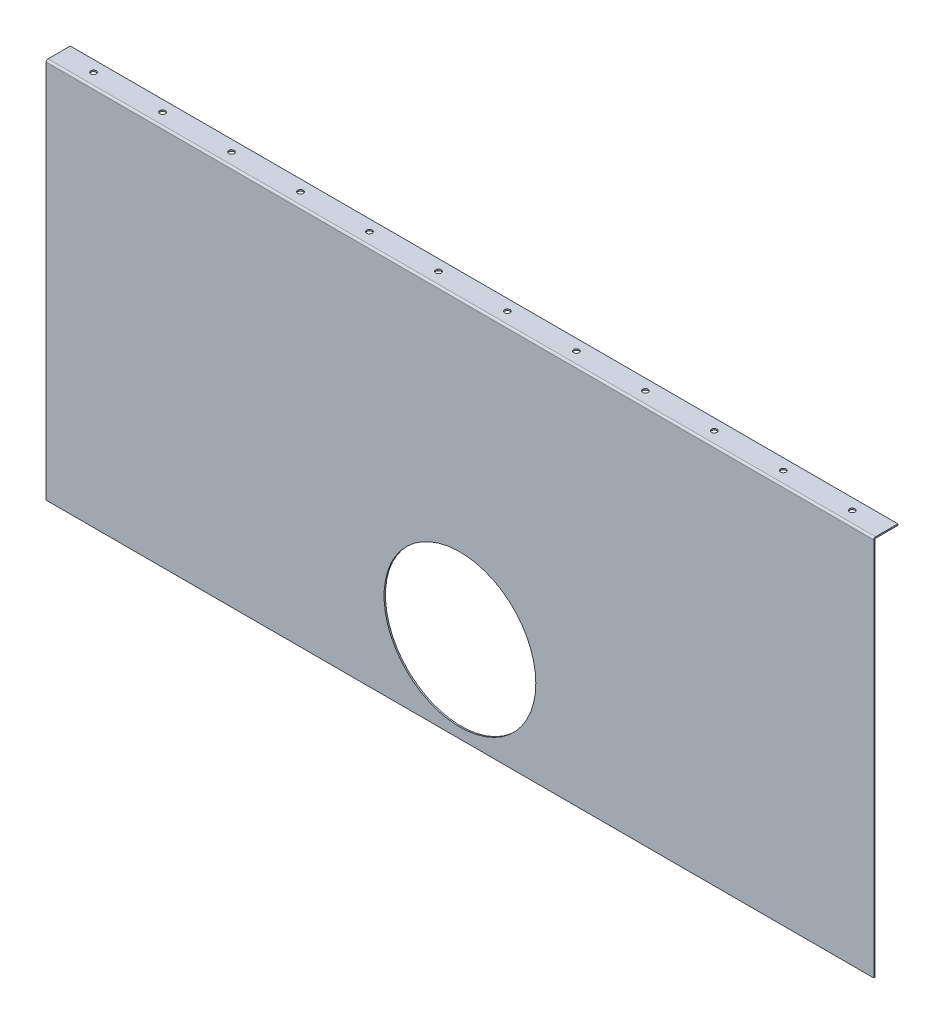
from build123d import *

# Parameters (mm, degrees)
SKETCH1_W          = 1200
SKETCH1_H          = 550
BASE_FLANGE1_DEPTH = 2
EDGE_FLANGE1_DEPTH = 1200
SKETCH9_R          = 4
CUT_EXTRUDE1_DEPTH = 10
SKETCH10_R         = 110
CUT_EXTRUDE2_DEPTH = 10


# Sheet-metal steps are written as plain solids
with BuildPart() as part:
    # Base-Flange1: sheet metal written as solids
    # Sketch1 → Base-Flange1 (new body)
    with BuildSketch(Plane.XY):
        Rectangle(SKETCH1_W, SKETCH1_H)
    extrude(amount=-BASE_FLANGE1_DEPTH)

    # Edge-Flange1: sheet metal written as solids
    # Edge-Flange1 section (on a plane across the edge) → Edge-Flange1 (add)
    with BuildSketch(Plane(origin=(-600, 275.7366, -2), x_dir=(0, -1, 0), z_dir=(1, 0, 0))):
        with BuildLine():
            Line((-2, 0.7366), (-2, 33))
            Line((-2, 33), (0, 33))
            Line((0, 33), (0, 0.7366))
            ThreePointArc((0, 0.7366), (0.215745145, 0.215745145), (0.7366, 0))
            Line((0.7366, 0), (0.7366, -2))
            ThreePointArc((0.7366, -2), (-1.198468417, -1.198468417), (-2, 0.7366))
        make_face()
    extrude(amount=EDGE_FLANGE1_DEPTH)

    # Sketch9 → Cut-Extrude1 (cut)
    with BuildSketch(Plane.XZ.offset(-275.7366)):
        with Locations(Location((-550, -18.8683, 0), (0, 0, 270))):
            Circle(SKETCH9_R)
        with Locations(Location((-450, -18.8683, 0), (0, 0, 270))):
            Circle(SKETCH9_R)
        with Locations(Location((-350, -18.8683, 0), (0, 0, 270))):
            Circle(SKETCH9_R)
        with Locations(Location((-250, -18.8683, 0), (0, 0, 270))):
            Circle(SKETCH9_R)
        with Locations(Location((-150, -18.8683, 0), (0, 0, 270))):
            Circle(SKETCH9_R)
        with Locations(Location((-50, -18.8683, 0), (0, 0, 270))):
            Circle(SKETCH9_R)
        with Locations(Location((50, -18.8683, 0), (0, 0, 270))):
            Circle(SKETCH9_R)
        with Locations(Location((150, -18.8683, 0), (0, 0, 270))):
            Circle(SKETCH9_R)
        with Locations(Location((250, -18.8683, 0), (0, 0, 270))):
            Circle(SKETCH9_R)
        with Locations(Location((350, -18.8683, 0), (0, 0, 270))):
            Circle(SKETCH9_R)
        with Locations(Location((450, -18.8683, 0), (0, 0, 270))):
            Circle(SKETCH9_R)
        with Locations(Location((550, -18.8683, 0), (0, 0, 270))):
            Circle(SKETCH9_R)
    extrude(amount=-CUT_EXTRUDE1_DEPTH, mode=Mode.SUBTRACT)

    # Sketch10 → Cut-Extrude2 (cut)
    with BuildSketch(Plane.XY):
        with Locations((0, -150)):
            Circle(SKETCH10_R)
    extrude(amount=-CUT_EXTRUDE2_DEPTH, mode=Mode.SUBTRACT)


solid = part.part
